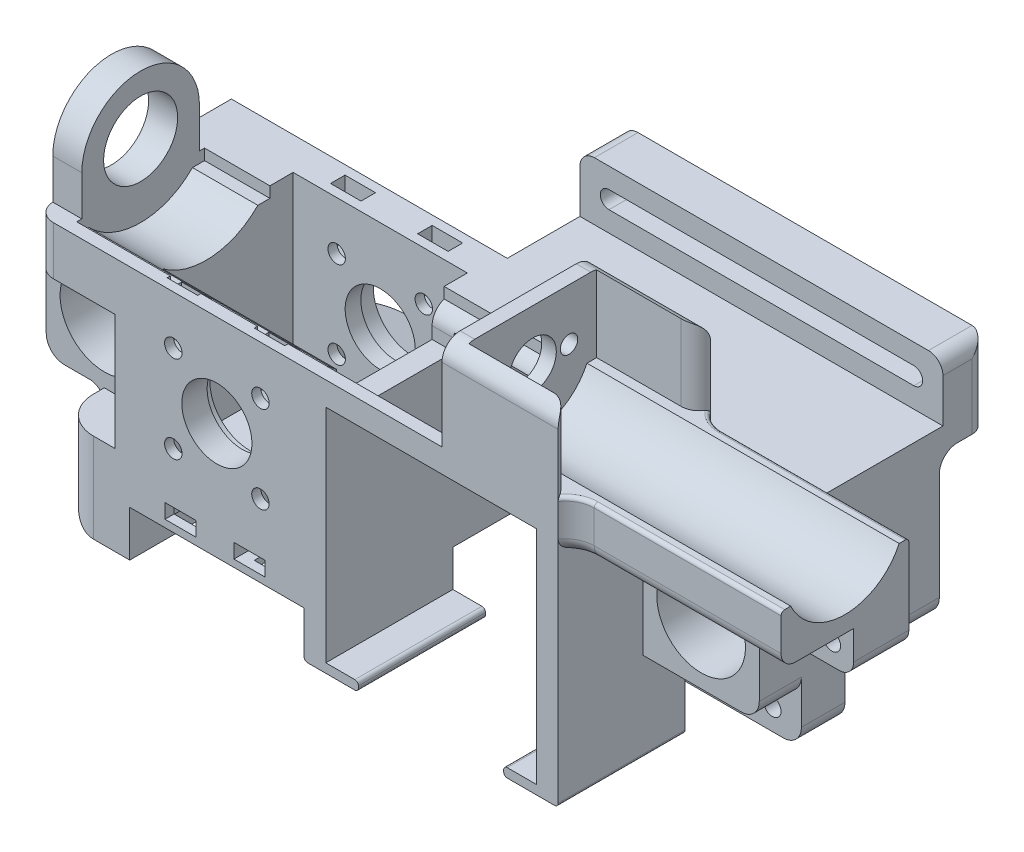
from build123d import *

# Parameters (mm, degrees)
SKETCH1_R                       = 6.099999999999995
SKETCH1_R_2                     = 6.1
BOSS_EXTRUDE1_DEPTH             = 43
BOSS_EXTRUDE2_DEPTH             = 7
SKETCH5_W                       = 28.30000000000002
SKETCH5_H                       = 28.999999999999975
CUT_EXTRUDE1_DEPTH              = 2
CUT_EXTRUDE2_REACH              = 96.884
SKETCH7_R                       = 4.830000000000005
CUT_EXTRUDE3_DEPTH              = 95.8841398759561
BOSS_EXTRUDE3_DEPTH             = 21
SKETCH10_R                      = 3.2500000000000013
SKETCH10_R_2                    = 1.2000000000000004
CUT_EXTRUDE5_DEPTH              = 2
SKETCH62_W                      = 20.000000000000007
SKETCH62_H                      = 26.000000000000004
CUT_EXTRUDE29_DEPTH             = 2
CUT_EXTRUDE7_DEPTH              = 16
SKETCH18_R                      = 5.099999999999954
BOSS_EXTRUDE4_DEPTH             = 4
SKETCH19_R                      = 5.459999999999992
CUT_EXTRUDE9_DEPTH              = 2.341
SKETCH21_R                      = 1.2000000000000004
BOSS_EXTRUDE5_DEPTH             = 4
SKETCH22_W                      = 1.6999999999999957
SKETCH22_H                      = 12.600000000000023
SKETCH22_W_2                    = 1.70000000000001
BOSS_EXTRUDE6_DEPTH             = 14
CUT_EXTRUDE13_DEPTH             = 4.5
CUT_EXTRUDE14_DEPTH             = 1
BOSS_EXTRUDE15_DEPTH            = 16
BOSS_EXTRUDE7_DEPTH             = 4
CUT_EXTRUDE15_DEPTH             = 2
CUT_EXTRUDE19_REACH             = 99.813
FILLET10_R                      = 3
CUT_EXTRUDE20_DEPTH             = 29.75
CUT_EXTRUDE20_DEPTH_BACK        = 0.75
BOSS_EXTRUDE9_DEPTH             = 0.3
BOSS_EXTRUDE14_REACH            = 83.92
CUT_EXTRUDE21_DEPTH             = 6.5
SKETCH61_R                      = 6.099999999999995
BOSS_EXTRUDE18_DEPTH            = 16
CUT_EXTRUDE22_DEPTH             = 101.6973683866664
CUT_EXTRUDE22_DEPTH_BACK        = 11.7
SKETCH43_R                      = 6.100000000000001
SKETCH45_W                      = 16.000000000000007
SKETCH45_H                      = 17.999999999999957
SKETCH45_R                      = 6.099999999999995
CUT_EXTRUDE23_DEPTH             = 6.5
SKETCH46_W                      = 16.000000000000007
SKETCH46_H                      = 17.999999999999957
CUT_EXTRUDE24_DEPTH             = 11.7
FILLET12_R                      = 8
CHAMFER1_SIZE                   = 10
M2_CLEARANCE_HOLE1_D            = 2.4
M2_CLEARANCE_HOLE1_DEPTH        = 4.5
M2_CLEARANCE_HOLE2_D            = 2.4
CUT_EXTRUDE27_START             = -1.25
CUT_EXTRUDE27_DEPTH             = 2
FILLET16_R                      = 2.5
FILLET20_R                      = 5
SKETCH64_W                      = 16.00000000000002
SKETCH64_H                      = 11.7
CUT_EXTRUDE30_DEPTH             = 1.7
CUT_EXTRUDE31_REACH             = 92.443
CUT_EXTRUDE31_DIRECTION_2_REACH = 92.443
FILLET24_R                      = 3
CUT_EXTRUDE33_DEPTH             = 15.500000000000007
CUT_EXTRUDE33_DEPTH_BACK        = 1.5
BOSS_EXTRUDE22_DEPTH            = 30
SKETCH73_W                      = 9.999999999999996
SKETCH73_H                      = 1.9999999999999964
BOSS_EXTRUDE23_DEPTH            = 16
FILLET21_R                      = 2.5
BOSS_EXTRUDE24_DEPTH            = 13
BOSS_EXTRUDE27_DEPTH            = 8
FILLET27_R                      = 2
FILLET28_R                      = 4
CUT_EXTRUDE34_REACH             = 107.22
SKETCH78_W                      = 16.000000000000007
SKETCH78_H                      = 11.282856857085672
BOSS_EXTRUDE28_DEPTH            = 8
CUT_EXTRUDE35_DEPTH             = 6
FILLET29_R                      = 2
CUT_EXTRUDE36_DEPTH             = 12.3
CUT_EXTRUDE37_DEPTH             = 3
SKETCH83_W                      = 29.00000000000001
SKETCH83_H                      = 38
CUT_EXTRUDE38_DEPTH             = 30.5
CUT_EXTRUDE39_REACH             = 93.143
SKETCH86_W                      = 5.9999999999999964
SKETCH86_H                      = 6.0000000000000115
BOSS_EXTRUDE29_DEPTH            = 16
M2_CLEARANCE_HOLE3_D            = 2.4
M2_CLEARANCE_HOLE3_DEPTH        = 6
M2_CLEARANCE_HOLE3_TIP          = 0.7210327428330723
CUT_EXTRUDE40_REACH             = 93.143
SKETCH91_W                      = 1.999999999999929
SKETCH91_H                      = 17.599999999999994
BOSS_EXTRUDE30_DEPTH            = 1.5
FILLET30_R                      = 2.5
FILLET33_R                      = 1
SKETCH94_W                      = 13
SKETCH94_H                      = 17.59999999999999
BOSS_EXTRUDE31_DEPTH            = 6
M2_CLEARANCE_HOLE4_D            = 2.4
SKETCH98_R                      = 2.4999999999999956
SKETCH98_R_2                    = 2.50000000000001
CUT_EXTRUDE41_DEPTH             = 3
FILLET34_R                      = 2
SKETCH99_R                      = 5.46
CUT_EXTRUDE42_DEPTH             = 1.016
SKETCH100_R                     = 5.46
SKETCH100_R_2                   = 4.830000000000005
BOSS_EXTRUDE32_DEPTH            = 1.016
SKETCH101_R                     = 5.459999999999992
SKETCH101_R_2                   = 4.830000000000005
BOSS_EXTRUDE33_DEPTH            = 2.341
FILLET35_R                      = 0.5
BOSS_EXTRUDE34_DEPTH            = 8
SKETCH103_W                     = 10.000000000000004
SKETCH103_H                     = 6.0000000000000036
CUT_EXTRUDE43_DEPTH             = 13
FILLET36_R                      = 5
FILLET37_R                      = 2


with BuildPart() as part:
    # Sketch1 → Boss-Extrude1 (new body)
    with BuildSketch(Plane.XY):
        Polygon((61, 4.23e-15), (27.000000000000007, 6e-17), (0, 0), (0, 12.299999999999999), (-16, 12.299999999999999), (-16.000000000000004, 28.299999999999997), (-7.0000000000000036, 28.299999999999997), (-7.000000000000004, 34.99999999999999), (0, 35), (26.999999999999996, 34.99999999999999), (61, 35), (77.00000000000001, 35), (77.00000000000001, 12.299999999999999), (61, 12.299999999999999), align=None)
        with Locations((69, 20.299999999999997)):
            Circle(SKETCH1_R, mode=Mode.SUBTRACT)
        with Locations((-8.000000000000002, 20.299999999999997)):
            Circle(SKETCH1_R_2, mode=Mode.SUBTRACT)
        Polygon((28.999999999999996, 31), (29.000000000000007, 2.000000000000049), (57.99999999999999, 2.0000000000000004), (57.99999999999999, 31.000000000000007), align=None, mode=Mode.SUBTRACT)
    extrude(amount=BOSS_EXTRUDE1_DEPTH)

    # Cut-Extrude2: up to this face of the body (flat: up to its plane)
    cut_extrude2_end = Plane(part.part.faces().sort_by_distance((30.5, 0, 21.5))[0])
    # Sketch6 → Cut-Extrude2 (cut, up to the picked face)
    with BuildSketch(Plane(origin=(-3.469e-14, 35, 0), x_dir=(1, -2.5e-16, 0), z_dir=(2.5e-16, 1, 0)), mode=Mode.PRIVATE) as cut_extrude2_sk1:
        Polygon((26.000000000000025, -20.5), (2.00000000000008, -20.500000000000004), (2.000000000000082, -38.5), (26.000000000000025, -38.5), align=None)
    cut_extrude2_tool1 = split(extrude(cut_extrude2_sk1.sketch, amount=-CUT_EXTRUDE2_REACH, mode=Mode.PRIVATE), bisect_by=cut_extrude2_end, keep=Keep.BOTH, mode=Mode.PRIVATE)
    # Sketch6 → Cut-Extrude2 (cut, up to the picked face)
    with BuildSketch(Plane(origin=(-3.469e-14, 35, 0), x_dir=(1, -2.5e-16, 0), z_dir=(2.5e-16, 1, 0)), mode=Mode.PRIVATE) as cut_extrude2_sk2:
        Polygon((-6.99999999999997, -16.000000000000004), (3e-17, -16.000000000000004), (27.000000000000036, -16.000000000000004), (27.000000000000032, 0), (0, 0), (-6.999999999999968, 0), align=None)
    cut_extrude2_tool2 = split(extrude(cut_extrude2_sk2.sketch, amount=-CUT_EXTRUDE2_REACH, mode=Mode.PRIVATE), bisect_by=cut_extrude2_end, keep=Keep.BOTH, mode=Mode.PRIVATE)
    add(cut_extrude2_tool1.solids().sort_by(Axis((14, 35, 29.5), (-2.5e-16, -1, 0)))[0], mode=Mode.SUBTRACT)
    add(cut_extrude2_tool2.solids().sort_by(Axis((10, 35, 8), (-2.5e-16, -1, 0)))[0], mode=Mode.SUBTRACT)

    # Sketch7 → Cut-Extrude3 (cut, through all)
    with BuildSketch(Plane.XY.offset(43)):
        with Locations((13.999999999999998, 22.3)):
            Circle(SKETCH7_R)
    extrude(amount=-CUT_EXTRUDE3_DEPTH, mode=Mode.SUBTRACT)

    # Sketch9 → Boss-Extrude3 (add)
    with BuildSketch(Plane.XY.offset(43)):
        Polygon((47, 47.600000000000016), (47, 34.99999999999999), (45, 35), (45, 47.600000000000016), align=None)
    extrude(amount=-BOSS_EXTRUDE3_DEPTH)

    # Sketch10 → Cut-Extrude5 (cut)
    with BuildSketch(Plane.ZY.offset(-45)):
        with Locations((32.5, 40.5)):
            Circle(SKETCH10_R)
        with Locations((27.5, 40.49999999999999)):
            Circle(SKETCH10_R_2)
        with Locations((37.5, 40.5)):
            Circle(SKETCH10_R_2)
    extrude(amount=-CUT_EXTRUDE5_DEPTH, mode=Mode.SUBTRACT)

    # Sketch62 → Cut-Extrude29 (cut)
    with BuildSketch(Plane.XZ):
        with Locations((43.5, 30)):
            Rectangle(SKETCH62_W, SKETCH62_H)
    extrude(amount=-CUT_EXTRUDE29_DEPTH, mode=Mode.SUBTRACT)

    # Sketch12 → Cut-Extrude7 (cut)
    with BuildSketch(Plane(origin=(0, 0, 0), x_dir=(-1, 0, 0), z_dir=(0, 0, -1))):
        Polygon((-25.999999999912465, 35), (-25.999999999912465, 3), (-1.2e-16, 3.0000000000000027), (0, 12.299999999999999), (16, 12.299999999999999), (16.000000000000004, 28.299999999999997), (7.000000000000005, 28.299999999999997), (7.000000000000003, 35), align=None)
    extrude(amount=-CUT_EXTRUDE7_DEPTH, mode=Mode.SUBTRACT)

    # Sketch17 one side → Cut-Revolve2 (revolve, cut)
    with BuildSketch(Plane.XY.offset(32.5)):
        Polygon((30.999999999999986, 30.5), (30.999999999999986, 40.49999999999999), (-7.000000000000014, 40.49999999999999), (-7.000000000000011, 30.500000000000007), (24.999999999999986, 30.500000000000007), align=None)
    revolve(axis=Axis((-7.000000000000017, 40.49999999999999, 32.5), (-1, 0, 0)), mode=Mode.SUBTRACT)

    # Sketch18 → Boss-Extrude4 (add)
    with BuildSketch(Plane.ZY.offset(7)):
        with BuildLine():
            ThreePointArc((40.599999999999994, 40.5), (32.5, 48.599999999999994), (24.400000000000006, 40.5))
            Line((24.400000000000002, 40.5), (24.400000000000002, 34.99999999999999))
            Line((24.400000000000002, 34.99999999999999), (16.000000000000007, 35))
            Line((16.000000000000007, 35), (16, 28.299999999999997))
            Line((16, 28.299999999999997), (43, 28.299999999999997))
            Line((43, 28.299999999999997), (43, 35))
            Line((43, 35), (40.599999999999994, 34.99999999999999))
            Line((40.599999999999994, 34.99999999999999), (40.599999999999994, 40.5))
        make_face()
        with Locations((32.5, 40.5)):
            Circle(SKETCH18_R, mode=Mode.SUBTRACT)
    extrude(amount=BOSS_EXTRUDE4_DEPTH)

    # Sketch19 → Cut-Extrude9 (cut)
    with BuildSketch(Plane.XY.offset(43)):
        with Locations((13.999999999999998, 22.3)):
            Circle(SKETCH19_R)
    cut_extrude9 = extrude(amount=-CUT_EXTRUDE9_DEPTH, mode=Mode.SUBTRACT)

    # Mirror1: Cut-Extrude9 across plane
    add(cut_extrude9.mirror(Plane.XY.offset(29.5)), mode=Mode.SUBTRACT)

    # Sketch21 → Boss-Extrude5 (add)
    with BuildSketch(Plane(origin=(-1.26e-15, 10.299999999999994, 0), x_dir=(-1, -1.2e-16, 0), z_dir=(1.2e-16, -1, 0))):
        Polygon((-25.999999999999993, -38.5), (-25.999999999999986, -20.5), (-2.0000000000000364, -20.500000000000004), (-2.000000000000036, -38.5), align=None)
        with Locations(Location((-18.499999999999996, -33.99999999999999, 0), (0, 0, 180))):
            Circle(SKETCH21_R, mode=Mode.SUBTRACT)
        with Locations(Location((-8.999999999999995, -33.99999999999999, 0), (0, 0, 180))):
            Circle(SKETCH21_R, mode=Mode.SUBTRACT)
    extrude(amount=BOSS_EXTRUDE5_DEPTH)

    # Sketch22 → Boss-Extrude6 (add)
    with BuildSketch(Plane(origin=(47, 0, 0), x_dir=(0, 0, -1), z_dir=(1, 1.31e-15, 0))):
        with Locations((-42.150000000000006, 41.300000000000004)):
            Rectangle(SKETCH22_W, SKETCH22_H)
        with Locations((-22.85, 41.300000000000004)):
            Rectangle(SKETCH22_W_2, SKETCH22_H)
    extrude(amount=BOSS_EXTRUDE6_DEPTH)

    # Sketch23 → Cut-Extrude13 (cut)
    with BuildSketch(Plane(origin=(0, 0, 38.5), x_dir=(-1, 0, 0), z_dir=(0, 0, -1))):
        Polygon((-25.999999999999986, 6.299999999999993), (-25.999999999999993, 3.18e-15), (-2.000000000000036, -3e-15), (-2.0000000000000404, 6.299999999999993), align=None)
    extrude(amount=-CUT_EXTRUDE13_DEPTH, mode=Mode.SUBTRACT)

    # Sketch24 → Cut-Extrude14 (cut, symmetric)
    with BuildSketch(Plane(origin=(-1.2e-15, 8.299999999999994, 0), x_dir=(-1, 1.4e-16, 0), z_dir=(-1.4e-16, -1, 0))):
        Polygon((-20.650000000000002, -35.241303078757696), (-20.650000000000002, -43), (-16.349999999999998, -43), (-16.35, -35.24130307875769), (-16.35, -32.758696921242304), (-18.499999999999996, -31.51739384248461), (-20.650000000000002, -32.75869692124231), align=None)
        Polygon((-6.849999999999992, -35.241303078757696), (-6.849999999999993, -32.758696921242304), (-9.000000000000002, -31.5173938424846), (-11.150000000000007, -32.758696921242304), (-11.150000000000007, -35.2413030787577), (-11.150000000000006, -43), (-6.849999999999992, -43), align=None)
    extrude(amount=CUT_EXTRUDE14_DEPTH, both=True, mode=Mode.SUBTRACT)

    # Sketch48 → Boss-Extrude15 (add)
    with BuildSketch(Plane(origin=(3.47e-15, 0, 16.000000000000004), x_dir=(-1, 0, 1.2e-16), z_dir=(-1.2e-16, 0, -1))):
        Polygon((0, 0), (0, 5), (-26.999999999999996, 4.999999999999997), (-27.000000000000007, 6e-17), align=None)
    extrude(amount=BOSS_EXTRUDE15_DEPTH)

    # Sketch26 → Boss-Extrude7 (add)
    with BuildSketch(Plane(origin=(0, 0, 0), x_dir=(-1, 0, 0), z_dir=(0, 0, -1))):
        Polygon((-7.799999999999992, 5.299999999999992), (-10.199999999999992, 5.299999999999992), (-10.19999999999999, 0), (-7.799999999999991, 1.1e-16), align=None)
    extrude(amount=BOSS_EXTRUDE7_DEPTH)


with BuildPart() as body_2:
    # Sketch3 → Boss-Extrude2 (new body)
    # profile 1 of 3: a face of its own
    with BuildSketch(Plane(origin=(0, 0, 0), x_dir=(-1, 0, 0), z_dir=(0, 0, -1))):
        Polygon((-57.650000000000006, 2.000000000000001), (-29.349999999999987, 2.0000000000000484), (-29.349999999999987, 31.00000000000001), (-57.650000000000006, 31.000000000000007), align=None)
        with BuildLine():
            ThreePointArc((-56.349999999999994, 6.500000000000025), (-54.99999999999999, 7.850000000000024), (-53.64999999999999, 6.500000000000027))
            Line((-53.64999999999999, 6.500000000000027), (-53.64999999999999, 3.5000000000000253))
            ThreePointArc((-53.64999999999999, 3.500000000000025), (-54.99999999999999, 2.150000000000026), (-56.349999999999994, 3.500000000000025))
            Line((-56.349999999999994, 3.500000000000025), (-56.349999999999994, 6.500000000000025))
        make_face(mode=Mode.SUBTRACT)
        with BuildLine():
            Line((-33.38738881971165, 3.5345129605011825), (-33.31175292560921, 6.533559344191059))
            ThreePointArc((-33.31175292560921, 6.533559344191059), (-31.92814590060268, 7.849094064505401), (-30.612611180288336, 6.465487039498869))
            Line((-30.612611180288336, 6.465487039498869), (-30.688247074390773, 3.4664406558089906))
            ThreePointArc((-30.68824707439077, 3.4664406558089906), (-32.07185409939731, 2.1509059354946505), (-33.387388819711646, 3.534512960501182))
        make_face(mode=Mode.SUBTRACT)
        with BuildLine():
            ThreePointArc((-32.3, 15.000000000000025), (-43.49999999999999, 3.800000000000031), (-54.69999999999999, 15.000000000000025))
            Line((-54.699999999999996, 15.000000000000025), (-54.699999999999996, 18.000000000000018))
            ThreePointArc((-54.699999999999996, 18.00000000000002), (-43.50000000000001, 29.200000000000024), (-32.300000000000004, 18.00000000000003))
            Line((-32.3, 18.00000000000003), (-32.3, 15.000000000000025))
        make_face(mode=Mode.SUBTRACT)
        with BuildLine():
            Line((-53.650000000000006, 29.500000000000025), (-53.650000000000006, 26.500000000000025))
            ThreePointArc((-53.650000000000006, 26.500000000000025), (-54.99999999999999, 25.150000000000034), (-56.34999999999998, 26.500000000000025))
            Line((-56.34999999999998, 26.500000000000025), (-56.34999999999998, 29.500000000000025))
            ThreePointArc((-56.34999999999998, 29.500000000000025), (-54.99999999999999, 30.850000000000016), (-53.650000000000006, 29.500000000000025))
        make_face(mode=Mode.SUBTRACT)
        with BuildLine():
            ThreePointArc((-30.649999999999995, 26.500000000000025), (-31.999999999999996, 25.150000000000023), (-33.349999999999994, 26.500000000000025))
            Line((-33.349999999999994, 26.500000000000025), (-33.349999999999994, 29.500000000000025))
            ThreePointArc((-33.349999999999994, 29.500000000000025), (-31.999999999999996, 30.850000000000023), (-30.65, 29.500000000000025))
            Line((-30.649999999999995, 29.500000000000025), (-30.649999999999995, 26.500000000000025))
        make_face(mode=Mode.SUBTRACT)
    # profile 2 of 3: a face of its own
    with BuildSketch(Plane(origin=(0, 0, 0), x_dir=(-1, 0, 0), z_dir=(0, 0, -1))):
        Polygon((-57.99999999999999, 2.0000000000000004), (-57.650000000000006, 2.000000000000001), (-57.650000000000006, 31.00000000000001), (-57.99999999999999, 31.000000000000007), align=None)
    # profile 3 of 3: a face of its own
    with BuildSketch(Plane(origin=(0, 0, 0), x_dir=(-1, 0, 0), z_dir=(0, 0, -1))):
        Polygon((-29.349999999999987, 2.0000000000000484), (-29.000000000000007, 2.000000000000049), (-28.999999999999996, 31), (-29.349999999999987, 31), align=None)
    extrude(amount=-BOSS_EXTRUDE2_DEPTH)

    # Sketch5 → Cut-Extrude1 (cut)
    with BuildSketch(Plane.XY.offset(7)):
        with Locations((43.5, 16.50000000000003)):
            Rectangle(SKETCH5_W, SKETCH5_H)
    extrude(amount=-CUT_EXTRUDE1_DEPTH, mode=Mode.SUBTRACT)


with BuildPart() as cut_extrude15_tool:
    # Sketch27 → Cut-Extrude15 (new body)
    with BuildSketch(Plane(origin=(0, 0, 0), x_dir=(-1, 0, 0), z_dir=(0, 0, -1))):
        with BuildLine():
            Line((-57.85, 6.500000000000025), (-57.85, 3.500000000000025))
            ThreePointArc((-57.85, 3.500000000000025), (-54.99999999999999, 0.6500000000000168), (-52.14999999999999, 3.5000000000000244))
            Line((-52.14999999999999, 3.5000000000000244), (-52.14999999999999, 6.500000000000027))
            ThreePointArc((-52.14999999999999, 6.500000000000027), (-54.99999999999999, 9.350000000000026), (-57.85, 6.500000000000025))
        make_face()
        with BuildLine():
            Line((-29.1130879884434, 6.42766909244765), (-29.188723882545833, 3.4286227087577728))
            ThreePointArc((-29.188723882545833, 3.4286227087577728), (-32.10967204644852, 0.6513827436497), (-34.886912011556596, 3.572330907552399))
            Line((-34.886912011556596, 3.572330907552399), (-34.811276117454156, 6.5713772912422765))
            ThreePointArc((-34.811276117454156, 6.5713772912422765), (-31.890327953551463, 9.348617256350341), (-29.1130879884434, 6.42766909244765))
        make_face()
        with BuildLine():
            Line((-29.149999999999995, 26.500000000000025), (-29.149999999999995, 29.500000000000025))
            ThreePointArc((-29.149999999999995, 29.500000000000025), (-31.999999999999993, 32.35000000000002), (-34.849999999999994, 29.500000000000025))
            Line((-34.849999999999994, 29.500000000000025), (-34.849999999999994, 26.500000000000025))
            ThreePointArc((-34.849999999999994, 26.500000000000025), (-31.999999999999993, 23.650000000000023), (-29.149999999999995, 26.500000000000025))
        make_face()
        with BuildLine():
            Line((-57.85000000000001, 26.500000000000025), (-57.85000000000001, 29.500000000000025))
            ThreePointArc((-57.85000000000001, 29.500000000000025), (-54.99999999999999, 32.35000000000002), (-52.15, 29.500000000000025))
            Line((-52.15, 29.500000000000025), (-52.14999999999999, 26.500000000000025))
            ThreePointArc((-52.14999999999999, 26.500000000000025), (-54.99999999999999, 23.65000000000001), (-57.85000000000001, 26.500000000000025))
        make_face()
    extrude(amount=-CUT_EXTRUDE15_DEPTH)


with BuildPart() as part_1:
    add(part.part)

    # Cut-Extrude15: cut by cut_extrude15_tool
    add(cut_extrude15_tool.part, mode=Mode.SUBTRACT)


with BuildPart() as body_2_1:
    add(body_2.part)

    # Cut-Extrude15: cut by cut_extrude15_tool
    add(cut_extrude15_tool.part, mode=Mode.SUBTRACT)

    # Combine1: union part
    add(part_1.part)

    # Sketch34 → Cut-Extrude19 (cut, up to next)
    with BuildSketch(Plane.XZ.offset(-6.299999999999993), mode=Mode.PRIVATE) as cut_extrude19_sk1:
        Polygon((4.99999999999999, 29.499999999999996), (4.999999999999991, 22.5), (22.99999999999999, 22.5), (22.99999999999999, 29.5), align=None)
    cut_extrude19_tool1 = extrude(cut_extrude19_sk1.sketch, amount=-CUT_EXTRUDE19_REACH, mode=Mode.PRIVATE) & body_2_1.part
    add(cut_extrude19_tool1.solids().sort_by_distance((14, 6.3, 26))[0], mode=Mode.SUBTRACT)

    # Fillet10
    fillet10_edges = [body_2_1.edges().sort_by_distance(p)[0] for p in [
        (4.999999999999989, 8.299999999999994, 29.499999999999996),
        (22.99999999999999, 8.299999999999994, 29.5),
        (22.99999999999999, 8.299999999999994, 22.5),
        (4.99999999999999, 8.299999999999994, 22.5),
    ]]
    fillet(fillet10_edges, radius=FILLET10_R)

    # Sketch35 → Cut-Extrude20 (cut, two sides: drawn at the far end of the back side and taken through both)
    with BuildSketch(Plane.XZ.offset(-30.999999999999993).offset(-CUT_EXTRUDE20_DEPTH_BACK)):
        Polygon((29.000000000000004, 7), (29.349999999999994, 7), (29.349999999999994, 5), (57.65000000000001, 5), (57.65000000000001, 7), (58, 7), (58, 43), (29.000000000000004, 43), (29.00000000000001, 35.62249899919919), (30.999999999999996, 35.622498999199195), (30.999999999999996, 29.377501000800805), (29.00000000000001, 29.377501000800816), align=None)
    extrude(amount=CUT_EXTRUDE20_DEPTH + CUT_EXTRUDE20_DEPTH_BACK, mode=Mode.SUBTRACT)

    # Sketch38 → Boss-Extrude9 (add)
    with BuildSketch(Plane(origin=(4.8e-16, 5, 0), x_dir=(1, -9e-17, 0), z_dir=(9e-17, 1, 0))):
        Polygon((26.99999999999999, 0), (10.19999999999999, 0), (7.799999999999992, 0), (1.14e-15, 0), (2.99e-15, -16.000000000000004), (27, -16), align=None)
    extrude(amount=BOSS_EXTRUDE9_DEPTH)

    # Boss-Extrude14: up to this face of the body (flat: up to its plane)
    boss_extrude14_end = Plane(body_2_1.part.faces().sort_by_distance((0, 5.438078676, 25.126769009))[0])
    # Sketch42 → Boss-Extrude14 (add, up to the picked face)
    with BuildSketch(Plane.ZY.offset(-26.99999999999999), mode=Mode.PRIVATE) as boss_extrude14_sk1:
        Polygon((16.000000000000007, 10.300000000000004), (4.36e-15, 5.299999999999999), (16.000000000000007, 5.299999999999999), align=None)
    boss_extrude14_tool1 = split(extrude(boss_extrude14_sk1.sketch, amount=BOSS_EXTRUDE14_REACH, mode=Mode.PRIVATE), bisect_by=boss_extrude14_end, keep=Keep.BOTH, mode=Mode.PRIVATE)
    add(boss_extrude14_tool1.solids().sort_by(Axis((27, 6.966667, 10.666667), (-1, 2.5e-16, 2.4e-16)))[0])

    # Sketch44 → Cut-Extrude21 (cut)
    with BuildSketch(Plane.XY.offset(43)):
        Polygon((-16.000000000000004, 28.299999999999997), (0, 28.299999999999994), (-2.71e-15, 12.299999999999999), (-16, 12.299999999999999), align=None)
    extrude(amount=-CUT_EXTRUDE21_DEPTH, mode=Mode.SUBTRACT)

    # Sketch61 → Boss-Extrude18 (add)
    with BuildSketch(Plane(origin=(3.47e-15, 0, 16.000000000000004), x_dir=(-1, 0, 1.2e-16), z_dir=(-1.2e-16, 0, -1))):
        Polygon((16.000000000000004, 28.299999999999997), (0, 28.299999999999994), (9.8e-16, 12.299999999999999), (16, 12.299999999999999), align=None)
        with Locations((8.000000000000005, 20.299999999999997)):
            Circle(SKETCH61_R, mode=Mode.SUBTRACT)
    extrude(amount=BOSS_EXTRUDE18_DEPTH)

    # Sketch43 → Cut-Extrude22 (cut, two sides: drawn at the far end of the back side and taken through both)
    with BuildSketch(Plane(origin=(0, 0, 0), x_dir=(-1, 0, 0), z_dir=(0, 0, -1)).offset(-CUT_EXTRUDE22_DEPTH_BACK)):
        Polygon((16, 12.299999999999999), (16.000000000000004, 28.299999999999997), (0, 28.299999999999994), (2.71e-15, 12.299999999999999), align=None)
        with Locations((8.000000000000002, 20.299999999999997)):
            Circle(SKETCH43_R, mode=Mode.SUBTRACT)
    extrude(amount=CUT_EXTRUDE22_DEPTH + CUT_EXTRUDE22_DEPTH_BACK, mode=Mode.SUBTRACT)

    # Sketch45 → Cut-Extrude23 (cut)
    with BuildSketch(Plane(origin=(0, 0, 0), x_dir=(-1, 0, 0), z_dir=(0, 0, -1))):
        with Locations((-69.00000000000001, 21.299999999999976)):
            Rectangle(SKETCH45_W, SKETCH45_H)
        with Locations((-69, 20.299999999999997)):
            Circle(SKETCH45_R, mode=Mode.SUBTRACT)
    extrude(amount=-CUT_EXTRUDE23_DEPTH, mode=Mode.SUBTRACT)

    # Sketch46 → Cut-Extrude24 (cut)
    with BuildSketch(Plane.XY.offset(43)):
        with Locations((69.00000000000001, 21.299999999999976)):
            Rectangle(SKETCH46_W, SKETCH46_H)
    extrude(amount=-CUT_EXTRUDE24_DEPTH, mode=Mode.SUBTRACT)

    # Fillet12
    fillet12_edges = [body_2_1.edges().sort_by_distance(p)[0] for p in [
        (33.5, 0.6250000000000027, 16.999999999999996),
        (53.50000000000001, 0.6250000000000061, 16.999999999999996),
    ]]
    fillet(fillet12_edges, radius=FILLET12_R)

    # Chamfer1
    # the kernel refuses this chamfer: 10 mm, written as the material it takes off along each edge
    with BuildSketch(Plane(origin=(25.99999999999998, 2.4e-16, 20.5), x_dir=(-1.5e-16, -1.8e-16, -1), z_dir=(-1, 0, 1.5e-16))) as chamfer1_piece_1_section:
        Polygon((CHAMFER1_SIZE, 0), (-1.78e-15, -CHAMFER1_SIZE), (0, 0), align=None)
    chamfer1_piece_1 = extrude(amount=23.999999999999943, mode=Mode.PRIVATE)
    chamfer1_piece_1 = split(chamfer1_piece_1, bisect_by=Plane(origin=(25.99999999999998, 6.299999999999993, 20.5), z_dir=(0, -1, 0)), keep=Keep.TOP, mode=Mode.PRIVATE)
    add(chamfer1_piece_1, mode=Mode.SUBTRACT)

    # M2 Clearance Hole1
    with Locations(Plane.XY.offset(43)):
        with Locations((8, 28.3), (20, 28.3), (8, 16.3), (20, 16.3)):
            Hole(M2_CLEARANCE_HOLE1_D / 2, depth=M2_CLEARANCE_HOLE1_DEPTH)

    # M2 Clearance Hole2 (through all)
    with Locations(Plane(origin=(3.47e-15, 0, 16.000000000000004), x_dir=(-1, 0, 1.2e-16), z_dir=(-1.2e-16, 0, -1))):
        with Locations((-20, 28.3), (-8, 28.3), (-8, 16.3), (-20, 16.3)):
            Hole(M2_CLEARANCE_HOLE2_D / 2)

    # Sketch57 → Cut-Extrude27 (cut)
    with BuildSketch(Plane(origin=(0, 0, 38.5), x_dir=(-1, 0, 0), z_dir=(0, 0, -1)).offset(CUT_EXTRUDE27_START)):
        Polygon((-22.099999999999998, 35.000000000000064), (-22.099999999999998, 29.512435565298215), (-22.099999999999998, 27.08756443470179), (-20.000000000000004, 25.875128869403575), (-17.9, 27.087564434701786), (-17.9, 29.512435565298215), (-17.9, 35.000000000000064), align=None)
        Polygon((-5.899999999999992, 27.08756443470178), (-5.899999999999992, 29.512435565298215), (-5.899999999999993, 35.000000000000064), (-10.099999999999987, 35.00000000000007), (-10.100000000000005, 29.51243556529821), (-10.100000000000005, 27.08756443470178), (-7.9999999999999964, 25.875128869403564), align=None)
        Polygon((-5.899999999999994, 15.08756443470179), (-5.899999999999994, 17.512435565298226), (-7.999999999999991, 18.724871130596437), (-10.099999999999998, 17.512435565298222), (-10.099999999999998, 15.087564434701788), (-10.09999999999999, 6.299999999999991), (-5.899999999999992, 6.299999999999991), align=None)
        Polygon((-17.9, 15.087564434701786), (-17.9, 17.51243556529822), (-19.99999999999999, 18.72487113059643), (-22.099999999999994, 17.512435565298215), (-22.099999999999994, 15.087564434701786), (-22.099999999999998, 6.299999999999992), (-17.9, 6.299999999999991), align=None)
    cut_extrude27 = extrude(amount=-CUT_EXTRUDE27_DEPTH, mode=Mode.SUBTRACT)

    # Mirror2: Cut-Extrude27 across plane
    add(cut_extrude27.mirror(Plane.XY.offset(29.5)), mode=Mode.SUBTRACT)

    # Fillet16
    fillet16_edges = [body_2_1.edges().sort_by_distance(p)[0] for p in [
        (-11, 31.65, 43),
    ]]
    fillet(fillet16_edges, radius=FILLET16_R)

    # Fillet20
    # the kernel refuses this fillet: 5 mm, written as the material it adds along each edge
    with BuildSketch(Plane(origin=(-11, 28.299999999999997, 16.000000000000004), x_dir=(2.2e-16, 1, 0), z_dir=(1, -2.2e-16, -1.2e-16))) as fillet20_piece_1:
        with BuildLine():
            CenterArc((4.9507575177946705, -5), FILLET20_R, 90, 81.95215375268862)
            Line((4.619e-14, -4.300000000000011), (-0.09901515035584652, -4.286000000000012))
            ThreePointArc((-0.09901515035584652, -4.286000000000012), (-0.09999999999999787, -2.1500000000000057), (-0.10000000000000142, 0))
            Line((-0.10000000000000142, 0), (0, 0.10000000000000142))
            Line((0, 0.10000000000000142), (4.9507575177946705, 0.10000000000000142))
            Line((4.9507575177946705, 0.10000000000000142), (4.9507575177946705, 0))
        make_face()
    extrude(amount=11.000000000000004)
    with BuildSketch(Plane(origin=(-11, 28.299999999999997, 3.5), x_dir=(0, 1, 0), z_dir=(0, 0, 1))) as fillet20_piece_2_section:
        with BuildLine():
            CenterArc((FILLET20_R, FILLET20_R), FILLET20_R, 180, 90)
            Line((0, FILLET20_R), (-FILLET20_R * 0.02, FILLET20_R))
            Line((-FILLET20_R * 0.02, FILLET20_R), (-FILLET20_R * 0.02, -FILLET20_R * 0.02))
            Line((-FILLET20_R * 0.02, -FILLET20_R * 0.02), (FILLET20_R, -FILLET20_R * 0.02))
            Line((FILLET20_R, -FILLET20_R * 0.02), (FILLET20_R, 0))
        make_face()
    fillet20_piece_2 = extrude(amount=33, mode=Mode.PRIVATE)
    fillet20_piece_2 = split(fillet20_piece_2, bisect_by=Plane(origin=(-11, 28.299999999999997, 3.5), z_dir=(-2.2e-16, -1, 0)), keep=Keep.TOP, mode=Mode.PRIVATE)
    fillet20_piece_2 = split(fillet20_piece_2, bisect_by=Plane(origin=(-11, 28.299999999999997, 16.000000000000004), z_dir=(0, 0, -1)), keep=Keep.TOP, mode=Mode.PRIVATE)
    fillet20_piece_2 = split(fillet20_piece_2, bisect_by=Plane(origin=(-11, 28.299999999999997, 11.7), z_dir=(0, 0, 1)), keep=Keep.TOP, mode=Mode.PRIVATE)
    add(fillet20_piece_2)
    with BuildSketch(Plane(origin=(-11, 28.299999999999997, 16), x_dir=(0, 1, 0), z_dir=(0, 0, 1))) as fillet20_piece_3_section:
        with BuildLine():
            CenterArc((FILLET20_R, FILLET20_R), FILLET20_R, 180, 90)
            Line((0, FILLET20_R), (-FILLET20_R * 0.02, FILLET20_R))
            Line((-FILLET20_R * 0.02, FILLET20_R), (-FILLET20_R * 0.02, -FILLET20_R * 0.02))
            Line((-FILLET20_R * 0.02, -FILLET20_R * 0.02), (FILLET20_R, -FILLET20_R * 0.02))
            Line((FILLET20_R, -FILLET20_R * 0.02), (FILLET20_R, 0))
        make_face()
    fillet20_piece_3 = extrude(amount=20.5, mode=Mode.PRIVATE)
    fillet20_piece_3 = split(fillet20_piece_3, bisect_by=Plane(origin=(-11, 28.299999999999997, 16), z_dir=(2.2e-16, 1, 0)), keep=Keep.TOP, mode=Mode.PRIVATE)
    add(fillet20_piece_3)
    with BuildSketch(Plane(origin=(-11, 28.299999999999997, 16), x_dir=(0, 1, 0), z_dir=(0, 0, 1))) as fillet20_piece_4_section:
        with BuildLine():
            CenterArc((FILLET20_R, FILLET20_R), FILLET20_R, 180, 90)
            Line((0, FILLET20_R), (-FILLET20_R * 0.02, FILLET20_R))
            Line((-FILLET20_R * 0.02, FILLET20_R), (-FILLET20_R * 0.02, -FILLET20_R * 0.02))
            Line((-FILLET20_R * 0.02, -FILLET20_R * 0.02), (FILLET20_R, -FILLET20_R * 0.02))
            Line((FILLET20_R, -FILLET20_R * 0.02), (FILLET20_R, 0))
        make_face()
    fillet20_piece_4 = extrude(amount=20.5, mode=Mode.PRIVATE)
    fillet20_piece_4 = split(fillet20_piece_4, bisect_by=Plane(origin=(-11, 28.299999999999997, 16), z_dir=(-2.2e-16, -1, 0)), keep=Keep.TOP, mode=Mode.PRIVATE)
    add(fillet20_piece_4)
    with BuildSketch(Plane(origin=(-11, 28.299999999999997, 3.5), x_dir=(0, 1, 0), z_dir=(0, 0, 1))) as fillet20_piece_5a_section:
        with BuildLine():
            CenterArc((FILLET20_R, FILLET20_R), FILLET20_R, 180, 90)
            Line((0, FILLET20_R), (-FILLET20_R * 0.02, FILLET20_R))
            Line((-FILLET20_R * 0.02, FILLET20_R), (-FILLET20_R * 0.02, -FILLET20_R * 0.02))
            Line((-FILLET20_R * 0.02, -FILLET20_R * 0.02), (FILLET20_R, -FILLET20_R * 0.02))
            Line((FILLET20_R, -FILLET20_R * 0.02), (FILLET20_R, 0))
        make_face()
    fillet20_piece_5a = extrude(amount=33, mode=Mode.PRIVATE)
    fillet20_piece_5a = split(fillet20_piece_5a, bisect_by=Plane(origin=(-11, 28.299999999999997, 3.5), z_dir=(2.2e-16, 1, 0)), keep=Keep.TOP, mode=Mode.PRIVATE)
    fillet20_piece_5a = split(fillet20_piece_5a, bisect_by=Plane(origin=(-11, 28.299999999999997, 16.000000000000004), z_dir=(0, 0, -1)), keep=Keep.TOP, mode=Mode.PRIVATE)
    fillet20_piece_5a = split(fillet20_piece_5a, bisect_by=Plane(origin=(-11, 28.299999999999997, 11.7), z_dir=(0, 0, 1)), keep=Keep.TOP, mode=Mode.PRIVATE)
    with BuildSketch(Plane(origin=(-23.37689379448669, 28.299999999999997, 16.000000000000007), x_dir=(2.2e-16, 1, 0), z_dir=(1, -2.2e-16, -1.2e-16))) as fillet20_piece_5b_section:
        with BuildLine():
            CenterArc((4.9507575177946705, -5), FILLET20_R, 90, 81.95215375268862)
            Line((4.619e-14, -4.300000000000011), (-0.09901515035584652, -4.286000000000012))
            ThreePointArc((-0.09901515035584652, -4.286000000000012), (-0.09999999999999787, -2.1500000000000057), (-0.10000000000000142, 0))
            Line((-0.10000000000000142, 0), (0, 0.10000000000000142))
            Line((0, 0.10000000000000142), (4.9507575177946705, 0.10000000000000142))
            Line((4.9507575177946705, 0.10000000000000142), (4.9507575177946705, 0))
        make_face()
    fillet20_piece_5b = extrude(amount=23.37689379448669, mode=Mode.PRIVATE)
    fillet20_piece_5b = split(fillet20_piece_5b, bisect_by=Plane(origin=(-11, 28.299999999999997, 16.000000000000007), z_dir=(-1, 0, 0)), keep=Keep.TOP, mode=Mode.PRIVATE)
    fillet20_piece_5b = split(fillet20_piece_5b, bisect_by=Plane(origin=(-16.000000000000004, 28.299999999999997, 16.000000000000007), z_dir=(1, 2.2e-16, 0)), keep=Keep.TOP, mode=Mode.PRIVATE)
    fillet20_piece_5 = fillet20_piece_5a & fillet20_piece_5b
    add(fillet20_piece_5)

    # Sketch64 → Cut-Extrude30 (cut)
    with BuildSketch(Plane.XZ.offset(-30.299999999999972)):
        Polygon((77.00000000000001, 0), (77.00000000000001, 6.499999999999999), (60.99999999999999, 6.5), (60.99999999999999, 0), align=None)
        with Locations((69, 37.15)):
            Rectangle(SKETCH64_W, SKETCH64_H)
    extrude(amount=-CUT_EXTRUDE30_DEPTH, mode=Mode.SUBTRACT)

    # Cut-Extrude31: up to this face of the body (flat: up to its plane)
    cut_extrude31_end = Plane(body_2_1.part.faces().sort_by_distance((77, 24.52086275, 19.443105123))[0])
    # Sketch65 → Cut-Extrude31 (cut, up to the picked face)
    with BuildSketch(Plane(origin=(47, 0, 0), x_dir=(0, 0, -1), z_dir=(1, 0, 0)), mode=Mode.PRIVATE) as cut_extrude31_sk1:
        Polygon((-41.300000000000004, 35.000000000000064), (-41.300000000000004, 33.5), (-23.700000000000006, 33.5), (-23.700000000000006, 34.99999999999999), align=None)
    cut_extrude31_tool1 = split(extrude(cut_extrude31_sk1.sketch, amount=CUT_EXTRUDE31_REACH, mode=Mode.PRIVATE), bisect_by=cut_extrude31_end, keep=Keep.BOTH, mode=Mode.PRIVATE)
    add(cut_extrude31_tool1.solids().sort_by(Axis((47, 34.25, 32.5), (1, 0, 0)))[0], mode=Mode.SUBTRACT)

    # Cut-Extrude31 direction 2: up to this face of the body (flat: up to its plane)
    cut_extrude31_direction_2_end = Plane(body_2_1.part.faces().sort_by_distance((-7, 37.75, 40.353705461))[0])
    # Sketch65 → Cut-Extrude31 direction 2 (cut, up to the picked face)
    with BuildSketch(Plane(origin=(47, 0, 0), x_dir=(0, 0, -1), z_dir=(1, 0, 0)), mode=Mode.PRIVATE) as cut_extrude31_direction_2_sk1:
        Polygon((-41.300000000000004, 35.000000000000064), (-41.300000000000004, 33.5), (-23.700000000000006, 33.5), (-23.700000000000006, 34.99999999999999), align=None)
    cut_extrude31_direction_2_tool1 = split(extrude(cut_extrude31_direction_2_sk1.sketch, amount=-CUT_EXTRUDE31_DIRECTION_2_REACH, mode=Mode.PRIVATE), bisect_by=cut_extrude31_direction_2_end, keep=Keep.BOTH, mode=Mode.PRIVATE)
    add(cut_extrude31_direction_2_tool1.solids().sort_by(Axis((47, 34.25, 32.5), (-1, 0, 0)))[0], mode=Mode.SUBTRACT)

    # Fillet24
    fillet24_edges = [body_2_1.edges().sort_by_distance(p)[0] for p in [
        (0, 22.775378758897503, 16),
    ]]
    fillet(fillet24_edges, radius=FILLET24_R)

    # Sketch71 → Cut-Extrude33 (cut, two sides: drawn at the far end of the back side and taken through both)
    with BuildSketch(Plane(origin=(0, 33.5, 0), x_dir=(1, 0, 0), z_dir=(0, 1, 0)).offset(-CUT_EXTRUDE33_DEPTH_BACK)):
        Polygon((47, -41.3), (60.999999999999986, -41.3), (60.999999999999986, -43), (77.00000000000001, -43), (77.00000000000001, -41.3), (77.00000000000001, -23.700000000000006), (47, -23.700000000000006), align=None)
    extrude(amount=CUT_EXTRUDE33_DEPTH + CUT_EXTRUDE33_DEPTH_BACK, mode=Mode.SUBTRACT)

    # Sketch72 → Boss-Extrude22 (add)
    with BuildSketch(Plane(origin=(47, 0, 0), x_dir=(0, 0, -1), z_dir=(1, 0, 0))):
        with BuildLine():
            Line((-41.3, 37), (-41.3, 32))
            Line((-41.3, 32), (-23.700000000000006, 32))
            Line((-23.700000000000006, 32), (-23.700000000000006, 37))
            Line((-23.700000000000006, 37), (-25.029223601258032, 37))
            ThreePointArc((-25.029223601258032, 37), (-32.5, 32.25), (-39.97077639874197, 37))
            Line((-39.97077639874197, 37), (-41.3, 37))
        make_face()
    extrude(amount=BOSS_EXTRUDE22_DEPTH)

    # Sketch73 → Boss-Extrude23 (add)
    with BuildSketch(Plane(origin=(77.00000000000001, 0, 0), x_dir=(0, 0, -1), z_dir=(1, 0, 0))):
        with Locations((-36.3, 31)):
            Rectangle(SKETCH73_W, SKETCH73_H)
    extrude(amount=-BOSS_EXTRUDE23_DEPTH)

    # Fillet21
    # the kernel refuses this fillet: 2.5 mm, written as the material it adds along each edge
    with BuildSketch(Plane(origin=(77.00000000000001, 31.999999999999957, 6.499999999999999), x_dir=(-6e-17, 0, -1), z_dir=(-1, 1.7e-16, 6e-17))) as fillet21_piece_1_section:
        with BuildLine():
            CenterArc((FILLET21_R, FILLET21_R), FILLET21_R, 179.99999999999991, 90.00000000000011)
            Line((0, FILLET21_R), (0, 0))
            Line((0, 0), (FILLET21_R, 0))
        make_face()
    fillet21_piece_1 = extrude(amount=22.25000000000002, mode=Mode.PRIVATE)
    fillet21_piece_1 = split(fillet21_piece_1, bisect_by=Plane(origin=(57.650000000000006, 31.999999999999954, 6.499999999999999), z_dir=(1, 2.4e-16, 0)), keep=Keep.TOP, mode=Mode.PRIVATE)
    add(fillet21_piece_1)
    with BuildSketch(Plane(origin=(77.00000000000001, 30, 31.3), x_dir=(0, -1, -1.42e-15), z_dir=(-1, 0, 0))) as fillet21_piece_2_section:
        with BuildLine():
            CenterArc((FILLET21_R, FILLET21_R), FILLET21_R, 180.00000000000009, 90)
            Line((-3.55e-15, FILLET21_R), (0, 0))
            Line((0, 0), (FILLET21_R, 0))
        make_face()
    fillet21_piece_2 = extrude(amount=22.25, mode=Mode.PRIVATE)
    fillet21_piece_2 = split(fillet21_piece_2, bisect_by=Plane(origin=(57.99999999999999, 29.999999999999996, 31.3), z_dir=(1, 2.4e-16, 0)), keep=Keep.TOP, mode=Mode.PRIVATE)
    add(fillet21_piece_2)
    # the kernel refuses this fillet: 2.5 mm, written as the material it takes off along each edge
    with BuildSketch(Plane(origin=(-16, 12.299999999999999, 42.75), x_dir=(1, 0, 5e-17), z_dir=(5e-17, 0, -1))) as fillet21_2_piece_1:
        with BuildLine():
            CenterArc((FILLET21_R, -FILLET21_R), FILLET21_R, 90, 89.99999999999997)
            Line((0, -FILLET21_R), (0, 0))
            Line((0, 0), (FILLET21_R, 0))
        make_face()
    extrude(amount=37.3, mode=Mode.SUBTRACT)

    # Sketch74 → Boss-Extrude24 (add)
    with BuildSketch(Plane(origin=(77.00000000000001, 0, 0), x_dir=(0, 0, -1), z_dir=(1, 0, 0))):
        with BuildLine():
            Line((-41.300000000000004, 37), (-41.3, 30))
            Line((-41.3, 30), (-23.700000000000006, 30))
            Line((-23.700000000000006, 30), (-23.700000000000006, 37))
            Line((-23.700000000000006, 37), (-25.029223601258032, 37))
            ThreePointArc((-25.029223601258032, 37), (-32.5, 32.249999999999986), (-39.97077639874198, 37))
            Line((-39.97077639874198, 37), (-41.300000000000004, 37))
        make_face()
    extrude(amount=BOSS_EXTRUDE24_DEPTH)

    # Sketch77 → Boss-Extrude27 (add)
    with BuildSketch(Plane.ZY):
        Polygon((16.000000000000004, 12.299999999999999), (16.000000000000004, 10.300000000000004), (3.2000000000000015, 6.299999999999993), (43, 6.299999999999998), (43, 12.300000000000002), align=None)
    extrude(amount=BOSS_EXTRUDE27_DEPTH)

    # Fillet27
    fillet27_edges = [body_2_1.edges().sort_by_distance(p)[0] for p in [
        (-8, 12.3, 26.25),
    ]]
    fillet(fillet27_edges, radius=FILLET27_R)

    # Fillet28
    # the kernel refuses this fillet: 4 mm, written as the material it adds along each edge
    with BuildSketch(Plane(origin=(61.000000000000014, 30, 41.3), x_dir=(1, 8.12e-15, 0), z_dir=(-8.12e-15, 1, 0))) as fillet28_piece_1:
        with BuildLine():
            CenterArc((3.2726136343906944, -4), FILLET28_R, 90, 54.90036780460653)
            Line((-2.132e-14, -1.7000000000000028), (0, 0))
            Line((0, 0), (3.2726136343906944, 0))
        make_face()
    extrude(amount=7)
    with BuildSketch(Plane(origin=(60.99999999999995, 37, 23.700000000000006), x_dir=(-4.18e-15, 0, -1), z_dir=(1.31e-15, -1, 0))) as fillet28_piece_2:
        with BuildLine():
            CenterArc((3.9999999999999862, 3.2726136343907326), FILLET28_R, 180.00000000000023, 54.90036780460662)
            Line((-1.368e-14, 3.2726136343907157), (0, 0))
            Line((0, 0), (1.7000000000000064, 0))
        make_face()
    extrude(amount=10.181534085976779)

    # Cut-Extrude34: up to this face of the body (flat: up to its plane)
    cut_extrude34_end = Plane(body_2_1.part.faces().sort_by_distance((43.741784955, 31.75, 23.871071708))[0])
    # Sketch78 → Cut-Extrude34 (cut, up to the picked face)
    with BuildSketch(Plane(origin=(0, 33.5, 0), x_dir=(1, 0, 0), z_dir=(0, 1, 0)), mode=Mode.PRIVATE) as cut_extrude34_sk1:
        with Locations((37, -32.5)):
            Rectangle(SKETCH78_W, SKETCH78_H)
    cut_extrude34_tool1 = split(extrude(cut_extrude34_sk1.sketch, amount=-CUT_EXTRUDE34_REACH, mode=Mode.PRIVATE), bisect_by=cut_extrude34_end, keep=Keep.BOTH, mode=Mode.PRIVATE)
    add(cut_extrude34_tool1.solids().sort_by(Axis((37, 33.5, 32.5), (0, -1, 0)))[0], mode=Mode.SUBTRACT)

    # Sketch79 → Boss-Extrude28 (add)
    with BuildSketch(Plane(origin=(-3.469e-14, 35, 0), x_dir=(1, 9.9e-16, 0), z_dir=(-9.9e-16, 1, 0))):
        Polygon((77.00000000000004, 0), (27.000000000000032, -6.12e-15), (27.000000000000032, -6.000000000000006), (77.00000000000004, -6), align=None)
    extrude(amount=BOSS_EXTRUDE28_DEPTH)

    # Sketch80 → Cut-Extrude35 (cut)
    with BuildSketch(Plane.XY.offset(6.00000000000001)):
        with BuildLine():
            Line((73, 40.20000000000004), (30.99999999999999, 40.20000000000003))
            ThreePointArc((30.99999999999999, 40.20000000000003), (30.151471862576138, 39.84852813742389), (29.79999999999999, 39.00000000000004))
            ThreePointArc((29.79999999999999, 39.00000000000004), (30.15147186257613, 38.15147186257618), (30.99999999999999, 37.80000000000003))
            Line((30.99999999999999, 37.80000000000003), (73, 37.80000000000004))
            ThreePointArc((73, 37.80000000000004), (73.84852813742386, 38.15147186257618), (74.2, 39.00000000000004))
            ThreePointArc((74.2, 39.00000000000004), (73.84852813742386, 39.848528137423905), (73, 40.20000000000004))
        make_face()
    extrude(amount=-CUT_EXTRUDE35_DEPTH, mode=Mode.SUBTRACT)

    # Fillet29
    fillet29_edges = [body_2_1.edges().sort_by_distance(p)[0] for p in [
        (77, 37.500000000000014, 0),
        (77, 43.00000000000008, 3),
        (26.99999999999999, 43.00000000000003, 3.000000000000006),
    ]]
    fillet(fillet29_edges, radius=FILLET29_R)

    # Sketch81 → Cut-Extrude36 (cut)
    with BuildSketch(Plane(origin=(0, 12.299999999999999, 0), x_dir=(-1, 0, 0), z_dir=(0, -1, 0))):
        Polygon((11.783841071718369, 0), (0, -1.32e-15), (1.73e-15, -16.000000000000007), (11.78384107171837, -16.000000000000007), align=None)
    extrude(amount=CUT_EXTRUDE36_DEPTH, mode=Mode.SUBTRACT)

    # Sketch82 → Cut-Extrude37 (cut)
    with BuildSketch(Plane(origin=(0, 0, 0), x_dir=(-1, 0, 0), z_dir=(0, 0, -1))):
        with BuildLine():
            Line((-73, 36.75000000000004), (-30.99999999999999, 36.750000000000036))
            ThreePointArc((-30.99999999999999, 36.750000000000036), (-28.74999999999999, 39.000000000000036), (-30.999999999999986, 41.250000000000036))
            Line((-30.999999999999986, 41.250000000000036), (-73, 41.25000000000004))
            ThreePointArc((-73, 41.25000000000004), (-75.25, 39.00000000000004), (-73, 36.75000000000004))
        make_face()
    extrude(amount=-CUT_EXTRUDE37_DEPTH, mode=Mode.SUBTRACT)

    # Sketch83 → Cut-Extrude38 (cut)
    with BuildSketch(Plane(origin=(2.09e-15, 1.2500000000000977, 0), x_dir=(1, -1.67e-15, 0), z_dir=(1.67e-15, 1, 0))):
        with Locations((43.50000000000001, -24)):
            Rectangle(SKETCH83_W, SKETCH83_H)
    extrude(amount=CUT_EXTRUDE38_DEPTH, mode=Mode.SUBTRACT)

    # Cut-Extrude39: up to this face of the body (flat: up to its plane)
    cut_extrude39_end = Plane(body_2_1.part.faces().sort_by_distance((61, 42.3, 42.15))[0])
    # Sketch85 → Cut-Extrude39 (cut, up to the picked face)
    with BuildSketch(Plane.ZY.offset(-25.999999999999986), mode=Mode.PRIVATE) as cut_extrude39_sk1:
        Polygon((10.499999999999932, 6.38e-15), (25.499999999999932, 0), (25.499999999999932, 6.3000000000000025), (16.799999999999862, 6.3000000000000025), align=None)
    cut_extrude39_tool1 = split(extrude(cut_extrude39_sk1.sketch, amount=-CUT_EXTRUDE39_REACH, mode=Mode.PRIVATE), bisect_by=cut_extrude39_end, keep=Keep.BOTH, mode=Mode.PRIVATE)
    add(cut_extrude39_tool1.solids().sort_by(Axis((26, 2.870886, 19.435443), (1, -2.5e-16, 0)))[0], mode=Mode.SUBTRACT)

    # Sketch86 → Boss-Extrude29 (add)
    with BuildSketch(Plane(origin=(61, 0, 0), x_dir=(0, 0, -1), z_dir=(1, 0, 0))):
        with Locations((-22.49999999999993, 9.299999999999994)):
            Rectangle(SKETCH86_W, SKETCH86_H)
    extrude(amount=BOSS_EXTRUDE29_DEPTH)

    # M2 Clearance Hole3
    with Locations(Plane(origin=(0, 0, 19.499999999999932), x_dir=(-1, 0, 0), z_dir=(0, 0, -1))):
        with Locations((-73, 9.3), (-65, 9.3)):
            Hole(M2_CLEARANCE_HOLE3_D / 2, depth=M2_CLEARANCE_HOLE3_DEPTH)
            with Locations((0, 0, -(M2_CLEARANCE_HOLE3_DEPTH + M2_CLEARANCE_HOLE3_TIP / 2))):  # 118° drill point
                Cone(0, M2_CLEARANCE_HOLE3_D / 2, M2_CLEARANCE_HOLE3_TIP, mode=Mode.SUBTRACT)

    # Cut-Extrude40: up to this face of the body (flat: up to its plane)
    cut_extrude40_end = Plane(body_2_1.part.faces().sort_by_distance((45, 35.24489998, 42.15))[0])
    # Sketch90 → Cut-Extrude40 (cut, up to the picked face)
    with BuildSketch(Plane.ZY.offset(-25.999999999999986), mode=Mode.PRIVATE) as cut_extrude40_sk1:
        Polygon((25.358571571457148, 29.500000000000007), (39.64142842854285, 29.500000000000007), (39.64142842854285, 33.50000000000001), (25.358571571457148, 33.500000000000014), align=None)
    cut_extrude40_tool1 = split(extrude(cut_extrude40_sk1.sketch, amount=-CUT_EXTRUDE40_REACH, mode=Mode.PRIVATE), bisect_by=cut_extrude40_end, keep=Keep.BOTH, mode=Mode.PRIVATE)
    add(cut_extrude40_tool1.solids().sort_by(Axis((26, 31.5, 32.5), (1, -2.5e-16, 0)))[0], mode=Mode.SUBTRACT)

    # Sketch91 → Boss-Extrude30 (add)
    with BuildSketch(Plane.XZ.offset(-34.99999999999991)):
        with Locations((45.999999999999964, 32.50000000000014)):
            Rectangle(SKETCH91_W, SKETCH91_H)
    extrude(amount=BOSS_EXTRUDE30_DEPTH)

    # Fillet30
    # the kernel refuses this fillet: 2.5 mm, written as the material it takes off along each edge
    with BuildSketch(Plane(origin=(61, 4.23e-15, -6.250000000000002), x_dir=(-1, -9e-17, 0), z_dir=(0, 0, 1))) as fillet30_piece_1:
        with BuildLine():
            CenterArc((FILLET30_R, -FILLET30_R), FILLET30_R, 89.99999999999999, 89.99999999999999)
            Line((-2.3e-16, -FILLET30_R), (0, 0))
            Line((0, 0), (FILLET30_R, 0))
        make_face()
    extrude(amount=22.999999999999932, mode=Mode.SUBTRACT)
    with BuildSketch(Plane(origin=(77.00000000000001, 12.299999999999999, 0.25), x_dir=(-1, 0, 0), z_dir=(0, 0, 1))) as fillet30_piece_2:
        with BuildLine():
            CenterArc((FILLET30_R, -FILLET30_R), FILLET30_R, 90, 90)
            Line((0, -FILLET30_R), (0, 0))
            Line((0, 0), (FILLET30_R, 0))
        make_face()
    extrude(amount=19.249999999999932, mode=Mode.SUBTRACT)
    with BuildSketch(Plane(origin=(77.00000000000001, 12.299999999999999, 0.25), x_dir=(-1, 0, 0), z_dir=(0, 0, 1))) as fillet30_piece_3_section:
        with BuildLine():
            CenterArc((FILLET30_R, -FILLET30_R), FILLET30_R, 90, 90)
            Line((0, -FILLET30_R), (0, 0))
            Line((0, 0), (FILLET30_R, 0))
        make_face()
    fillet30_piece_3 = extrude(amount=25.499999999999932, mode=Mode.PRIVATE)
    fillet30_piece_3 = split(fillet30_piece_3, bisect_by=Plane(origin=(77.00000000000001, 12.299999999999999, 25.499999999999932), z_dir=(0, 0, 1)), keep=Keep.TOP, mode=Mode.PRIVATE)
    add(fillet30_piece_3, mode=Mode.SUBTRACT)
    with BuildSketch(Plane(origin=(77, 6.299999999999988, 31.749999999999932), x_dir=(-1, -2.13e-15, 0), z_dir=(0, 0, -1))) as fillet30_piece_4:
        with BuildLine():
            CenterArc((FILLET30_R, FILLET30_R), FILLET30_R, 180.00000000000003, 90.00000000000011)
            Line((-5.33e-15, FILLET30_R), (0, 0))
            Line((0, 0), (FILLET30_R, 0))
        make_face()
    extrude(amount=18.5, mode=Mode.SUBTRACT)
    with BuildSketch(Plane(origin=(67.24999999999994, 47.600000000000044, 43), x_dir=(1.33e-15, -1, 0), z_dir=(-1, -1.33e-15, 0))) as fillet30_piece_5:
        with BuildLine():
            CenterArc((FILLET30_R, -FILLET30_R), FILLET30_R, 90, 90)
            Line((0, -FILLET30_R), (0, 0))
            Line((0, 0), (FILLET30_R, 0))
        make_face()
    extrude(amount=28.499999999999943, mode=Mode.SUBTRACT)
    with BuildSketch(Plane(origin=(67.24999999999994, 47.600000000000044, 21.999999999999996), x_dir=(2.2e-16, -2.84e-15, 1), z_dir=(-1, -1.33e-15, 2.2e-16))) as fillet30_piece_6:
        with BuildLine():
            CenterArc((FILLET30_R, -FILLET30_R), FILLET30_R, 90.00000000000017, 89.99999999999983)
            Line((7.11e-15, -FILLET30_R), (0, 0))
            Line((0, 0), (FILLET30_R, 0))
        make_face()
    extrude(amount=28.499999999999943, mode=Mode.SUBTRACT)
    with BuildSketch(Plane(origin=(77.00000000000001, 12.299999999999999, 19.249999999999932), x_dir=(-1, 0, 0), z_dir=(0, 0, 1))) as fillet30_piece_7_section:
        with BuildLine():
            CenterArc((FILLET30_R, -FILLET30_R), FILLET30_R, 90, 90)
            Line((0, -FILLET30_R), (0, 0))
            Line((0, 0), (FILLET30_R, 0))
        make_face()
    fillet30_piece_7 = extrude(amount=18.300000000000065, mode=Mode.PRIVATE)
    fillet30_piece_7 = split(fillet30_piece_7, bisect_by=Plane(origin=(77.00000000000001, 12.299999999999999, 19.499999999999932), z_dir=(0, 0, -1)), keep=Keep.TOP, mode=Mode.PRIVATE)
    add(fillet30_piece_7, mode=Mode.SUBTRACT)
    with BuildSketch(Plane(origin=(77.00000000000001, 12.299999999999999, 25.499999999999932), x_dir=(-1, 0, 0), z_dir=(0, 0, 1))) as fillet30_piece_8:
        with BuildLine():
            CenterArc((FILLET30_R, -FILLET30_R), FILLET30_R, 90, 90)
            Line((0, -FILLET30_R), (0, 0))
            Line((0, 0), (FILLET30_R, 0))
        make_face()
    extrude(amount=12.050000000000065, mode=Mode.SUBTRACT)
    with BuildSketch(Plane(origin=(20.114637755605067, 33.5, 25.358571571457166), x_dir=(-7.5e-16, 0, -1), z_dir=(1, 0, -7.5e-16))) as fillet30_piece_9:
        with BuildLine():
            CenterArc((2.500000000000007, -2.3541448977579726), FILLET30_R, 109.66812058917357, 70.33187941082643)
            Line((7.11e-15, -2.3541448977579726), (0, 0))
            Line((0, 0), (1.6585715714571485, 0))
        make_face()
    extrude(amount=24.885362244394926, mode=Mode.SUBTRACT)
    with BuildSketch(Plane(origin=(60.99999999999995, 37, 41.300000000000004), x_dir=(-1, -1.31e-15, 0), z_dir=(-1.31e-15, 1, 0))) as fillet30_piece_10:
        with BuildLine():
            CenterArc((2.3685438564654007, 2.5), FILLET30_R, 198.66292488494256, 71.33707511505747)
            Line((0, 1.6999999999999957), (0, 0))
            Line((0, 0), (2.3685438564654007, 0))
        make_face()
    extrude(amount=16.521359641163535, mode=Mode.SUBTRACT)
    with BuildSketch(Plane(origin=(44.99999999999999, 33.49999999999999, 39.64142842854285), x_dir=(-3.7e-16, -1, 0), z_dir=(-1, 3.7e-16, 0))) as fillet30_piece_11:
        with BuildLine():
            CenterArc((2.354144897757976, 2.5), FILLET30_R, 199.6681205891733, 70.33187941082667)
            Line((0, 1.658571571457152), (0, 0))
            Line((0, 0), (2.354144897757976, 0))
        make_face()
    extrude(amount=19, mode=Mode.SUBTRACT)
    with BuildSketch(Plane(origin=(60.99999999999993, 53.521359641163556, 23.700000000000006), x_dir=(-1, -1.31e-15, 0), z_dir=(1.31e-15, -1, 0))) as fillet30_piece_12:
        with BuildLine():
            CenterArc((2.3685438564654078, 2.5), FILLET30_R, 198.6629248849422, 71.33707511505781)
            Line((0, 1.70000000000001), (0, 0))
            Line((0, 0), (2.3685438564654078, 0))
        make_face()
    extrude(amount=16.521359641163556, mode=Mode.SUBTRACT)

    # Fillet33
    fillet33_edges = [body_2_1.edges().sort_by_distance(p)[0] for p in [
        (8.999999999999993, 5.299999999999992, -4),
        (8.999999999999991, 1.1e-16, -4),
    ]]
    fillet(fillet33_edges, radius=FILLET33_R)

    # Sketch94 → Boss-Extrude31 (add)
    with BuildSketch(Plane.XZ.offset(-30)):
        with Locations((83.50000000000001, 32.5)):
            Rectangle(SKETCH94_W, SKETCH94_H)
    extrude(amount=BOSS_EXTRUDE31_DEPTH)

    # M2 Clearance Hole4 (through all)
    with Locations(Plane.XY.offset(41.3)):
        with Locations((80, 27), (87, 27)):
            Hole(M2_CLEARANCE_HOLE4_D / 2)

    # Sketch98 → Cut-Extrude41 (cut)
    with BuildSketch(Plane.XY.offset(41.3)):
        with Locations((80.00000000000001, 27)):
            Circle(SKETCH98_R)
        with Locations((87.00000000000001, 27)):
            Circle(SKETCH98_R_2)
    extrude(amount=-CUT_EXTRUDE41_DEPTH, mode=Mode.SUBTRACT)

    # Fillet34
    fillet34_edges = [body_2_1.edges().sort_by_distance(p)[0] for p in [
        (90.00000000000001, 24, 32.5),
        (77.00000000000001, 24, 36.3),
    ]]
    fillet(fillet34_edges, radius=FILLET34_R)

    # Sketch99 → Cut-Extrude42 (cut)
    with BuildSketch(Plane(origin=(0, 0, 38.5), x_dir=(-1, 0, 0), z_dir=(0, 0, -1))):
        with Locations(Location((-13.999999999999998, 22.3, 0), (0, 0, 180))):
            Circle(SKETCH99_R)
    cut_extrude42 = extrude(amount=-CUT_EXTRUDE42_DEPTH, mode=Mode.SUBTRACT)

    # Mirror3: Cut-Extrude42 across plane
    add(cut_extrude42.mirror(Plane.XY.offset(29.500000000000004)), mode=Mode.SUBTRACT)

    # Sketch100 → Boss-Extrude32 (add)
    with BuildSketch(Plane.XY.offset(20.500000000000004)):
        with Locations((13.999999999999995, 22.3)):
            Circle(SKETCH100_R)
        with Locations((13.999999999999995, 22.3)):
            Circle(SKETCH100_R_2, mode=Mode.SUBTRACT)
    extrude(amount=-BOSS_EXTRUDE32_DEPTH)

    # Sketch101 → Boss-Extrude33 (add)
    with BuildSketch(Plane.XY.offset(43)):
        with Locations((13.999999999999998, 22.3)):
            Circle(SKETCH101_R)
        with Locations((13.999999999999998, 22.3)):
            Circle(SKETCH101_R_2, mode=Mode.SUBTRACT)
    extrude(amount=-BOSS_EXTRUDE33_DEPTH)

    # Fillet35
    fillet35_edges = [body_2_1.edges().sort_by_distance(p)[0] for p in [
        (77.1363068171955, 37, 41.300000000000004),
        (77.1363068171955, 37, 23.700000000000006),
        (62.42870474293241, 37, 23.24964786985976),
        (62.4287047429324, 37, 41.750352130140236),
        (53.50000000000001, 1.2500000000000058, 34.249999999999964),
        (25.999999999999996, 2.33e-15, 34.249999999999964),
        (53.50000000000001, 6.49e-15, 34.249999999999964),
        (61, 4.23e-15, 34.249999999999964),
        (33.5, 4.07e-15, 34.24999999999997),
        (33.5, 1.2500000000000009, 34.249999999999964),
    ]]
    fillet(fillet35_edges, radius=FILLET35_R)

    # Sketch102 → Boss-Extrude34 (add)
    with BuildSketch(Plane.ZY):
        Polygon((0, 5.299999999999992), (0, 0), (43, 0), (43, 6.299999999999998), (16.000000000000007, 6.299999999999993), (16.000000000000007, 10.3), align=None)
    extrude(amount=BOSS_EXTRUDE34_DEPTH)

    # Sketch103 → Cut-Extrude43 (cut)
    with BuildSketch(Plane(origin=(90.00000000000001, 0, 0), x_dir=(0, 0, -1), z_dir=(1, 0, 0))):
        with Locations((-36.300000000000004, 27)):
            Rectangle(SKETCH103_W, SKETCH103_H)
    extrude(amount=-CUT_EXTRUDE43_DEPTH, mode=Mode.SUBTRACT)

    # Fillet36
    fillet36_edges = [body_2_1.edges().sort_by_distance(p)[0] for p in [
        (-8, 6.150000000000001, 43),
        (-8, 0, 21.5),
        (-8, 2.649999999999996, 0),
    ]]
    fillet(fillet36_edges, radius=FILLET36_R)

    # Fillet37
    fillet37_edges = [body_2_1.edges().sort_by_distance(p)[0] for p in [
        (77.1363068171955, 30, 41.3),
        (62.4287047429324, 30, 41.750352130140236),
    ]]
    fillet(fillet37_edges, radius=FILLET37_R)


solid = body_2_1.part
